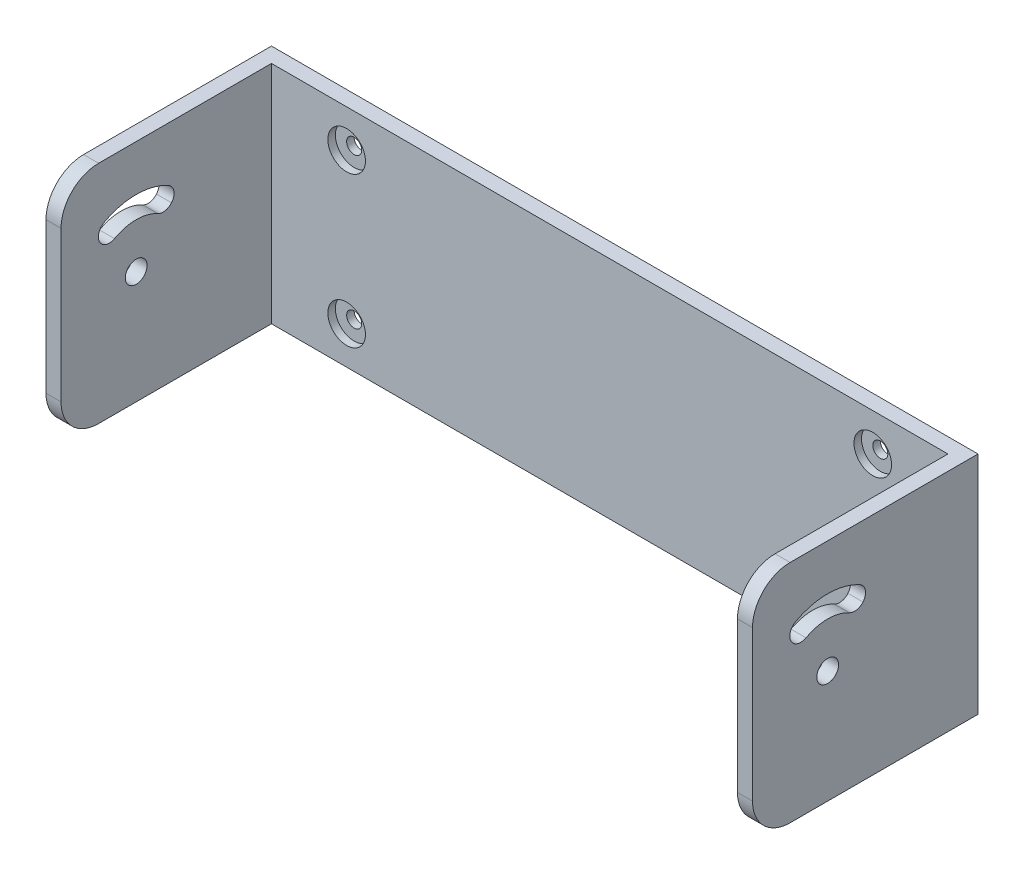
from build123d import *

# Parameters (mm, degrees)
SKETCH_1_W               = 180
SKETCH_1_H               = 60
EXTRUDE_1_DEPTH          = 4
SKETCH_4_R               = 2
CUT_EXTRUDE_2_DEPTH      = 50
SKETCH_8_R               = 5
CUT_EXTRUDE_6_DEPTH      = 2
SKETCH_9_W               = 60
SKETCH_9_H               = 60
EXTRUDE_2_DEPTH          = 4
SKETCH_10_W              = 60
SKETCH_10_H              = 60
EXTRUDE_3_DEPTH          = 4
CUT_EXTRUDE_7_DEPTH      = 200.609619007
CUT_EXTRUDE_7_DEPTH_BACK = 200.609619007
SKETCH_11_R              = 2.9
FILLET_1_R               = 2.9
FILLET_2_R               = 2.9
FILLET_3_R               = 10


with BuildPart() as part:
    # 草图1 → 凸台-拉伸1 (new body)
    with BuildSketch(Plane.XY):
        Rectangle(SKETCH_1_W, SKETCH_1_H)
    extrude(amount=EXTRUDE_1_DEPTH)

    # 草图4 → 切除-拉伸2 (cut)
    with BuildSketch(Plane.XY.offset(4)):
        with Locations((-70, 20)):
            Circle(SKETCH_4_R)
        with Locations((-70, -20)):
            Circle(SKETCH_4_R)
        with Locations((70, 20)):
            Circle(SKETCH_4_R)
        with Locations((70, -20)):
            Circle(SKETCH_4_R)
    extrude(amount=-CUT_EXTRUDE_2_DEPTH, mode=Mode.SUBTRACT)

    # 草图8 → 切除-拉伸6 (cut)
    with BuildSketch(Plane.XY.offset(4)):
        with Locations((70, 20)):
            Circle(SKETCH_8_R)
        with Locations((-70, 20)):
            Circle(SKETCH_8_R)
        with Locations((-70, -20)):
            Circle(SKETCH_8_R)
        with Locations((70, -20)):
            Circle(SKETCH_8_R)
    extrude(amount=-CUT_EXTRUDE_6_DEPTH, mode=Mode.SUBTRACT)

    # 草图9 → 凸台-拉伸2 (add)
    with BuildSketch(Plane(origin=(90, 0, 0), x_dir=(0, 0, -1), z_dir=(1, 0, 0))):
        with Locations((-30, 0)):
            Rectangle(SKETCH_9_W, SKETCH_9_H)
    extrude(amount=EXTRUDE_2_DEPTH)

    # 草图10 → 凸台-拉伸3 (add)
    with BuildSketch(Plane.ZY.offset(90)):
        with Locations((30, 0)):
            Rectangle(SKETCH_10_W, SKETCH_10_H)
    extrude(amount=EXTRUDE_3_DEPTH)

    # 草图11 → 切除-拉伸7 (cut, two sides: drawn at the far end of the back side and taken through both)
    with BuildSketch(Plane.ZY.offset(94).offset(-CUT_EXTRUDE_7_DEPTH_BACK)):
        with Locations(Location((40, 0, 0), (0, 0, 270))):
            Circle(SKETCH_11_R)
        with BuildLine():
            Line((47.713451316, 9.192533317), (51.441619452, 13.635591088))
            ThreePointArc((51.441619452, 13.635591088), (40, 17.8), (28.558380548, 13.635591088))
            Line((28.558380548, 13.635591088), (32.286548684, 9.192533317))
            ThreePointArc((32.286548684, 9.192533317), (40, 12), (47.713451316, 9.192533317))
        make_face()
    extrude(amount=CUT_EXTRUDE_7_DEPTH + CUT_EXTRUDE_7_DEPTH_BACK, mode=Mode.SUBTRACT)

    # 圆角1
    fillet_1_edges = [part.edges().sort_by_distance(p)[0] for p in [
        (-92, 13.635591088, 51.441619452),
        (-92, 9.192533317, 47.713451316),
        (-92, 13.635591088, 28.558380548),
        (-92, 9.192533317, 32.286548684),
    ]]
    fillet(fillet_1_edges, radius=FILLET_1_R - 0.0001)  # a hair under: the kernel refuses the full size

    # 圆角2
    fillet_2_edges = [part.edges().sort_by_distance(p)[0] for p in [
        (92, 13.635591088, 28.558380548),
        (92, 13.635591088, 51.441619452),
        (92, 9.192533317, 47.713451316),
        (92, 9.192533317, 32.286548684),
    ]]
    fillet(fillet_2_edges, radius=FILLET_2_R - 0.0001)  # a hair under: the kernel refuses the full size

    # 圆角3
    fillet_3_edges = [part.edges().sort_by_distance(p)[0] for p in [
        (92, 30, 60),
        (92, -30, 60),
        (-92, -30, 60),
        (-92, 30, 60),
    ]]
    fillet(fillet_3_edges, radius=FILLET_3_R)


solid = part.part
